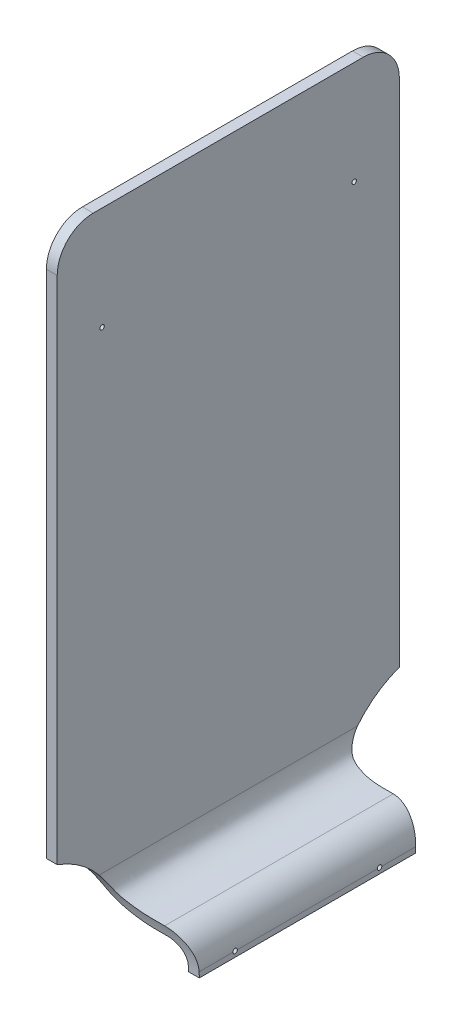
from build123d import *

# Parameters (mm, degrees)
EXTRUDE_THIN1_START     = -120.65
EXTRUDE_THIN1_DEPTH     = 241.3
FILLET1_R               = 25.4
FILLET2_R               = 25.4
CUT_EXTRUDE1_DEPTH      = 10.922
CUT_EXTRUDE1_DEPTH_BACK = 470.033978435
CUT_EXTRUDE2_DEPTH      = 14.224
CUT_EXTRUDE2_DEPTH_BACK = 17.78
SKETCH4_R               = 1.5875
CUT_EXTRUDE5_DEPTH      = 15.24
CUT_EXTRUDE5_DEPTH_BACK = 39.37
SKETCH6_R               = 1.5875


# Read off the part's stored shape, not the designer's step: Extrude-Thin1
with BuildPart() as part:
    # Extrude-Thin1 outline → Extrude-Thin1 (new body)
    with BuildSketch(Plane.XY.offset(EXTRUDE_THIN1_START)):
        with BuildLine():
            Line((-48.136484633, 42.398252654), (-48.136484633, 448.798252654))
            Line((-48.136484633, 448.798252654), (-55.756484633, 448.798252654))
            Line((-55.756484633, 448.798252654), (-55.756484633, 42.398252654))
            add(Edge.make_bspline(
                [(-12.565002774, 16.4226331), (-18.660422341, 16.648783951), (-29.593721838, 15.294803784), (-53.049054612, 24.063414555), (-55.748751869, 38.087730663), (-55.756484633, 42.398252654)],
                knots=[0, 0, 0, 0, 0.47979288, 0.674983069, 1, 1, 1, 1], degree=3))
            ThreePointArc((-12.565002774, 16.4226331), (-3.680204107, 12.742428993), (0, 3.857630326))
            Line((0, 3.857630326), (0, 0))
            Line((0, 0), (7.62, 0))
            Line((7.62, 0), (7.62, 3.857630326))
            ThreePointArc((7.62, 3.857630326), (1.761769959, 18.076558557), (-12.412488704, 24.042056908))
            add(Edge.make_bspline(
                [(-12.412488704, 24.042056908), (-14.262208623, 24.106140034), (-16.054759942, 24.078028651), (-19.666309734, 24.046159547), (-21.4850908, 24.039414372), (-25.260641796, 24.188692796), (-27.216781122, 24.343381658), (-30.330916862, 24.801554499), (-31.39895125, 24.992078959), (-33.055395991, 25.349419575), (-33.616606074, 25.480472941), (-34.758646701, 25.769107201), (-35.340221437, 25.926603185), (-37.052406147, 26.429710426), (-38.164623862, 26.811504496), (-40.201493957, 27.664037033), (-41.124128275, 28.13509499), (-42.284444288, 28.872281958), (-42.634290788, 29.122643674), (-43.100505125, 29.498715159), (-43.246220105, 29.624160936), (-43.450579345, 29.811881133), (-43.51636005, 29.874385921), (-43.649067646, 30.004760605), (-43.715258474, 30.071948921), (-44.309224288, 30.694807665), (-44.825849376, 31.382344205), (-45.776124403, 32.973984326), (-46.20816477, 33.875744733), (-46.944137411, 35.767951586), (-47.248356988, 36.757617062), (-47.719156141, 38.676711786), (-47.885935678, 39.606985364), (-48.042550102, 40.82976044), (-48.079286167, 41.208412507), (-48.125975073, 41.878883872), (-48.135737799, 42.17124376), (-48.136484633, 42.398252654)],
                knots=[0, 0, 0, 0, 0.125, 0.125, 0.25, 0.25, 0.375, 0.375, 0.4375, 0.4375, 0.46875, 0.46875, 0.5, 0.5, 0.5625, 0.5625, 0.625, 0.625, 0.65625, 0.65625, 0.671875, 0.671875, 0.6796875, 0.6796875, 0.6875, 0.6875, 0.75, 0.75, 0.8125, 0.8125, 0.875, 0.875, 0.9375, 0.9375, 0.96875, 0.96875, 1, 1, 1, 1], degree=3))
        make_face()
    extrude(amount=EXTRUDE_THIN1_DEPTH)

    # Fillet1
    fillet1_edges = [part.edges().sort_by_distance(p)[0] for p in [
        (-51.946484633, 448.798252654, 120.65),
    ]]
    fillet(fillet1_edges, radius=FILLET1_R)

    # Fillet2
    fillet2_edges = [part.edges().sort_by_distance(p)[0] for p in [
        (-51.946484633, 448.798252654, -120.65),
    ]]
    fillet(fillet2_edges, radius=FILLET2_R)

    # Sketch3 → Cut-Extrude1 (cut, two sides: drawn at the far end of the back side and taken through both)
    with BuildSketch(Plane(origin=(7.62, 0, 0), x_dir=(0, 0, -1), z_dir=(1, 0, 0)).offset(-CUT_EXTRUDE1_DEPTH_BACK)):
        with BuildLine():
            Line((-120.65, 0), (-120.65, 63.533291796))
            ThreePointArc((-120.65, 63.533291796), (-88.415746227, 38.769452106), (-76.2, 0))
            Line((-76.2, 0), (-120.65, 0))
        make_face()
        with BuildLine():
            Line((120.65, 0), (76.2, 0))
            ThreePointArc((76.2, 0), (88.415746227, 38.769452106), (120.65, 63.533291796))
            Line((120.65, 63.533291796), (120.65, 0))
        make_face()
    extrude(amount=CUT_EXTRUDE1_DEPTH + CUT_EXTRUDE1_DEPTH_BACK, mode=Mode.SUBTRACT)

    # Sketch4 → Cut-Extrude2 (cut, two sides: drawn at the far end of the back side and taken through both)
    with BuildSketch(Plane(origin=(-48.136484633, 0, 0), x_dir=(0, 0, -1), z_dir=(1, 0, 0)).offset(-CUT_EXTRUDE2_DEPTH_BACK)):
        with Locations(Location((-89.003908419, 375.92, 0), (0, 0, 180))):
            Circle(SKETCH4_R)
        with Locations(Location((88.803751124, 375.92, 0), (0, 0, 180))):
            Circle(SKETCH4_R)
    extrude(amount=CUT_EXTRUDE2_DEPTH + CUT_EXTRUDE2_DEPTH_BACK, mode=Mode.SUBTRACT)

    # Sketch6 → Cut-Extrude5 (cut, two sides: drawn at the far end of the back side and taken through both)
    with BuildSketch(Plane(origin=(7.62, 0, 0), x_dir=(0, 0, -1), z_dir=(1, 0, 0)).offset(-CUT_EXTRUDE5_DEPTH_BACK)):
        with Locations(Location((-50.940117855, 3.857630326, 0), (0, 0, 180))):
            Circle(SKETCH6_R)
        with Locations(Location((50.940117855, 3.857630326, 0), (0, 0, 180))):
            Circle(SKETCH6_R)
    extrude(amount=CUT_EXTRUDE5_DEPTH + CUT_EXTRUDE5_DEPTH_BACK, mode=Mode.SUBTRACT)


solid = part.part
